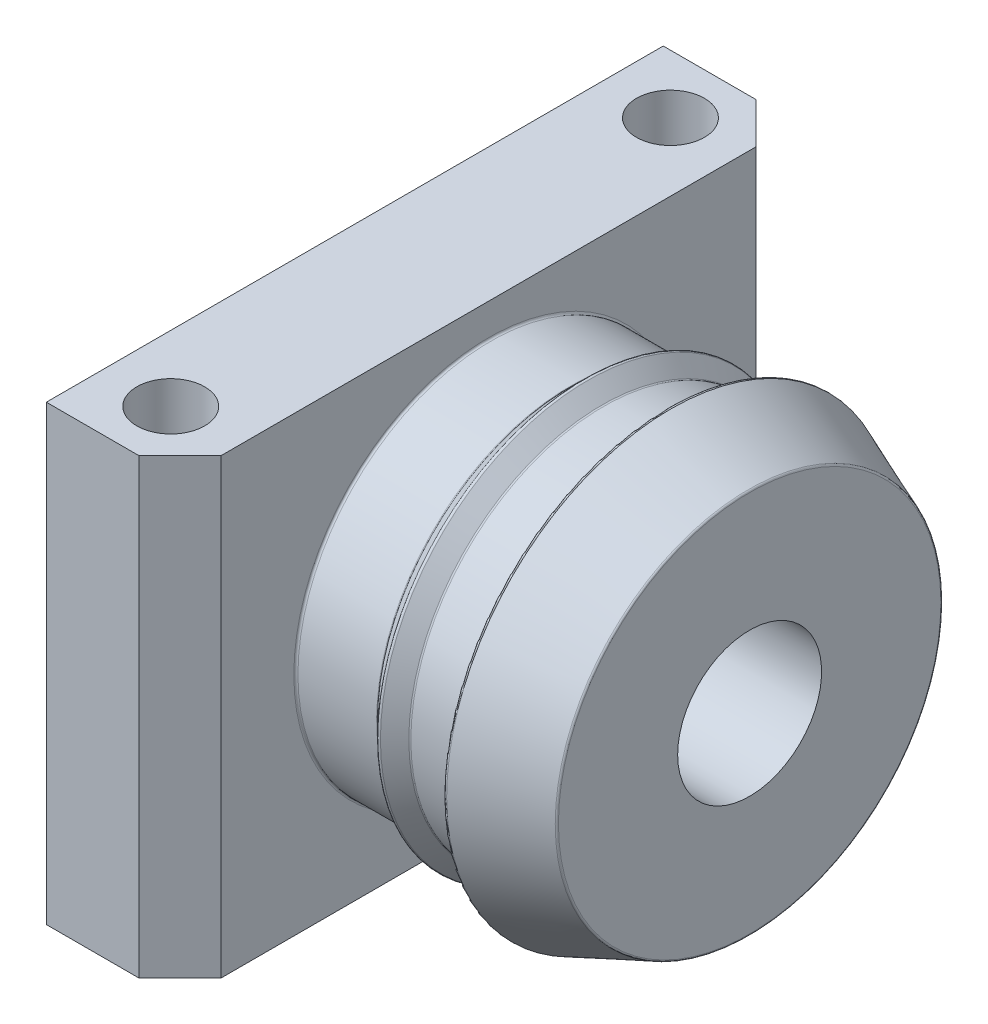
from build123d import *

# Parameters (mm, degrees)
SKETCH2_W               = 30
SKETCH2_H               = 22
SKETCH2_R               = 3.5
BOSS_EXTRUDE1_DEPTH     = 1.5
BOSS_EXTRUDE2_DEPTH     = 2
SKETCH2_4_R             = 0.9
BOSS_EXTRUDE3_DEPTH     = 5
SKETCH2_5_R             = 3.5
SKETCH2_5_W             = 2.46
SKETCH2_5_H             = 4.35
CUT_EXTRUDE1_DEPTH      = 23.523099254
BOSS_EXTRUDE4_START     = 1.5
SKETCH2_6_W             = 30
SKETCH2_6_H             = 22
SKETCH2_6_W_2           = 18.58
SKETCH2_6_H_2           = 14.05
BOSS_EXTRUDE4_DEPTH     = 5
FILLET1_R               = 0.1
FILLET4_R               = 0.2
FILLET5_R               = 0.2
SKETCH4_R               = 1.65
CUT_EXTRUDE2_DEPTH      = 29.352953991
CUT_EXTRUDE3_DEPTH      = 7
CUT_EXTRUDE3_DEPTH_BACK = 7
CUT_SWEEP1_PROFILE_R    = 0.889
FILLET6_R               = 0.2
CHAMFER1_SIZE           = 2


with BuildPart() as part:
    # Sketch1 → Revolve1 (revolve)
    with BuildSketch(Plane(origin=(0, 0, 0), x_dir=(1, 0, 0), z_dir=(0, 1, 0))):
        Polygon((0, 0), (-12.7, 0), (-12.7, 9.365), (-8.73, 9.365), (-7.94, 10.155), (-7.15, 9.365), (-3.97, 9.365), (-3.97, 10.955), (0, 9.365), align=None)
    revolve(axis=Axis((0, 0, 0), (-1, 0, 0)))

    # Sketch2 → Boss-Extrude1 (add)
    with BuildSketch(Plane.ZY.offset(12.7)):
        Rectangle(SKETCH2_W, SKETCH2_H)
        Circle(SKETCH2_R, mode=Mode.SUBTRACT)
    extrude(amount=BOSS_EXTRUDE1_DEPTH)

    # Sketch2<3> → Boss-Extrude2 (add)
    with BuildSketch(Plane.ZY.offset(12.7)):
        with BuildLine():
            ThreePointArc((-8.143254878, -4.625), (-7.532295819, -5.564866997), (-6.813413242, -6.425))
            Line((-6.813413242, -6.425), (6.813413242, -6.425))
            ThreePointArc((6.813413242, -6.425), (7.532295819, -5.564866997), (8.143254878, -4.625))
            Line((8.143254878, -4.625), (-8.143254878, -4.625))
        make_face()
        with BuildLine():
            ThreePointArc((8.143254878, -4.625), (7.532295819, -5.564866997), (6.813413242, -6.425))
            Line((6.813413242, -6.425), (8.59, -6.425))
            Line((8.59, -6.425), (8.59, -4.625))
            Line((8.59, -4.625), (8.143254878, -4.625))
        make_face()
        with BuildLine():
            Line((-8.59, -4.625), (-8.59, -6.425))
            Line((-8.59, -6.425), (-6.813413242, -6.425))
            ThreePointArc((-6.813413242, -6.425), (-7.532295819, -5.564866997), (-8.143254878, -4.625))
            Line((-8.143254878, -4.625), (-8.59, -4.625))
        make_face()
    extrude(amount=BOSS_EXTRUDE2_DEPTH)

    # Sketch2<4> → Boss-Extrude3 (add)
    with BuildSketch(Plane.ZY.offset(12.7)):
        with Locations((6.19, 3.935)):
            Circle(SKETCH2_4_R)
        with Locations((-6.19, 3.935)):
            Circle(SKETCH2_4_R)
    extrude(amount=BOSS_EXTRUDE3_DEPTH)

    # Sketch2<5> → Cut-Extrude1 (cut, through all)
    # profile 1 of 2: a face of its own
    with BuildSketch(Plane.ZY.offset(12.7)):
        Circle(SKETCH2_5_R)
        with Locations((-0.31, 0.56)):
            Rectangle(SKETCH2_5_W, SKETCH2_5_H, mode=Mode.SUBTRACT)
    # profile 2 of 2: a face of its own
    with BuildSketch(Plane.ZY.offset(12.7)):
        with Locations((-0.31, 0.56)):
            Rectangle(SKETCH2_5_W, SKETCH2_5_H)
    extrude(amount=-CUT_EXTRUDE1_DEPTH, mode=Mode.SUBTRACT)

    # Sketch2<6> → Boss-Extrude4 (add)
    with BuildSketch(Plane.ZY.offset(12.7).offset(BOSS_EXTRUDE4_START)):
        Rectangle(SKETCH2_6_W, SKETCH2_6_H)
        with Locations((0, -0.4)):
            Rectangle(SKETCH2_6_W_2, SKETCH2_6_H_2, mode=Mode.SUBTRACT)
    extrude(amount=BOSS_EXTRUDE4_DEPTH)

    # Fillet1
    fillet1_edges = [part.edges().sort_by_distance(p)[0] for p in [
        (-3.97, 0, 9.365),
        (-3.97, 0, 10.955),
        (0, 0, 9.365),
        (-12.7, 0, 9.365),
        (-8.73, 0, 9.365),
        (-7.94, 0, 10.155),
        (-7.15, 0, 9.365),
    ]]
    fillet(fillet1_edges, radius=FILLET1_R)

    # Fillet4
    fillet4_edges = [part.edges().sort_by_distance(p)[0] for p in [
        (-17.7, 3.935, 5.29),
        (-17.7, 3.935, -7.09),
    ]]
    fillet(fillet4_edges, radius=FILLET4_R)

    # Fillet5
    fillet5_edges = [part.edges().sort_by_distance(p)[0] for p in [
        (-14.7, -4.625, 0),
        (-14.7, -5.525, -8.59),
        (-14.7, -6.425, 0),
        (-14.7, -5.525, 8.59),
    ]]
    fillet(fillet5_edges, radius=FILLET5_R)

    # Sketch4 → Cut-Extrude2 (cut, symmetric)
    with BuildSketch(Plane(origin=(0, 3.5, 0), x_dir=(-1, 0, 0), z_dir=(0, -1, 0))):
        with Locations(Location((16, 12.15, 0), (0, 0, 90))):
            Circle(SKETCH4_R)
    cut_extrude2 = extrude(amount=CUT_EXTRUDE2_DEPTH, both=True, mode=Mode.SUBTRACT)

    # Mirror1: Cut-Extrude2 across plane
    add(cut_extrude2.mirror(Plane(origin=(0, 0, 0), x_dir=(1, 0, 0), z_dir=(0, 0, -1))), mode=Mode.SUBTRACT)

    # Sketch5 → Cut-Extrude3 (cut, two sides: drawn at the far end of the back side and taken through both)
    with BuildSketch(Plane(origin=(0, 0, 0), x_dir=(-1, 0, 0), z_dir=(0, 0, -1)).offset(-CUT_EXTRUDE3_DEPTH_BACK)):
        Polygon((17.9, -11), (17.9, -9.834230855), (15.4, -11), align=None)
    extrude(amount=CUT_EXTRUDE3_DEPTH + CUT_EXTRUDE3_DEPTH_BACK, mode=Mode.SUBTRACT)

    # Cut-Sweep1: sweep along a path in Sketch6
    with BuildLine(Plane.ZY.offset(19.2)) as cut_sweep1_path:
        Line((-9.29, 8.625), (9.29, 8.625))
        ThreePointArc((9.29, 8.625), (10.704213562, 8.039213562), (11.29, 6.625))
        Line((11.29, 6.625), (11.29, -6.425))
        ThreePointArc((11.29, -6.425), (10.704213562, -7.839213562), (9.29, -8.425))
        Line((9.29, -8.425), (-9.29, -8.425))
        ThreePointArc((-9.29, -8.425), (-10.704213562, -7.839213562), (-11.29, -6.425))
        Line((-11.29, -6.425), (-11.29, 6.625))
        ThreePointArc((-11.29, 6.625), (-10.704213562, 8.039213562), (-9.29, 8.625))
    # Cut-Sweep1 profile (on start of the path) → Cut-Sweep1 (sweep, cut)
    with BuildSketch(Plane(origin=(-19.2, 8.625, -9.29), x_dir=(1, 0, 0), z_dir=(0, 0, 1))):
        Circle(CUT_SWEEP1_PROFILE_R)
    sweep(path=cut_sweep1_path.line, mode=Mode.SUBTRACT)

    # Fillet6
    fillet6_edges = [part.edges().sort_by_distance(p)[0] for p in [
        (-14.2, 3.935, 5.29),
        (-14.2, 3.935, -7.09),
    ]]
    fillet(fillet6_edges, radius=FILLET6_R)

    # Chamfer1
    # the kernel refuses this chamfer: 2 mm, written as the material it takes off along each edge
    with BuildSketch(Plane(origin=(-12.7, 16.143365976, -15), x_dir=(-0.9996219169112968, 0, -0.027495876610586487), z_dir=(0, -1, 0)), Plane(origin=(-12.7, -16.143365976, 15), x_dir=(-0.9996219169112968, 0, 0.02749587661058735), z_dir=(0, 1, 0))) as chamfer1_piece_1:
        Polygon((CHAMFER1_SIZE * 0.999621916911, -CHAMFER1_SIZE * 0.0274958766106), (-CHAMFER1_SIZE * 0.0274958766106, -CHAMFER1_SIZE * 0.999621916911), (0, 0), align=None)
    extrude(amount=32.286731952, mode=Mode.SUBTRACT)


solid = part.part
